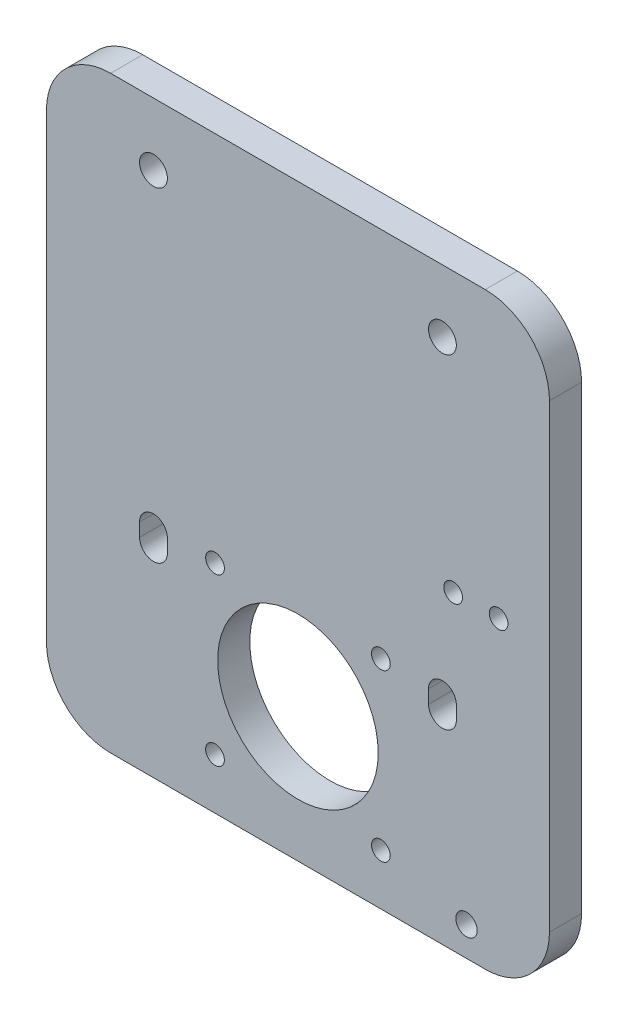
from build123d import *

# Parameters (mm, degrees)
MODEL_R                     = 15
MODEL_R_2                   = 2.6
BASE_DEPTH                  = 6
SKETCH2_R                   = 2
CABLETIEMOUNT_DEPTH         = 120.770614092
F_3_5_3_5_STEPPERMOUNT_D    = 3.5
F_3_5_3_5_CABLECHAINMOUNT_D = 3.5


with BuildPart() as part:
    # Model → Base (new body)
    with BuildSketch(Plane.XY):
        with BuildLine():
            Line((47, 12), (47, 98))
            ThreePointArc((47, 98), (43.485281374, 106.485281374), (35, 110))
            Line((35, 110), (-35, 110))
            ThreePointArc((-35, 110), (-43.485281374, 106.485281374), (-47, 98))
            Line((-47, 98), (-47, 12))
            ThreePointArc((-47, 12), (-43.485281374, 3.514718626), (-35, 0))
            Line((-35, 0), (35, 0))
            ThreePointArc((35, 0), (43.485281374, 3.514718626), (47, 12))
        make_face()
        with BuildLine():
            Line((-29.6, 37.6), (-29.6, 40.1))
            ThreePointArc((-29.6, 40.1), (-27, 42.7), (-24.4, 40.1))
            Line((-24.4, 40.1), (-24.4, 37.6))
            ThreePointArc((-24.4, 37.6), (-27, 35), (-29.6, 37.6))
        make_face(mode=Mode.SUBTRACT)
        with Locations((0, 25)):
            Circle(MODEL_R, mode=Mode.SUBTRACT)
        with BuildLine():
            Line((29.6, 40.1), (29.6, 37.6))
            ThreePointArc((29.6, 37.6), (27, 35), (24.4, 37.6))
            Line((24.4, 37.6), (24.4, 40.1))
            ThreePointArc((24.4, 40.1), (27, 42.7), (29.6, 40.1))
        make_face(mode=Mode.SUBTRACT)
        with Locations((-27, 98.3)):
            Circle(MODEL_R_2, mode=Mode.SUBTRACT)
        with Locations((27, 98.3)):
            Circle(MODEL_R_2, mode=Mode.SUBTRACT)
    extrude(amount=BASE_DEPTH)

    # Sketch2 → CableTieMount (cut, through all)
    with BuildSketch(Plane.XY.offset(6)):
        with Locations((31.5, 5.5)):
            Circle(SKETCH2_R)
    extrude(amount=-CABLETIEMOUNT_DEPTH, mode=Mode.SUBTRACT)

    # Ø3.5 (3.5) StepperMount (through all)
    with Locations(Plane.XY.offset(6)):
        with Locations((-15.5, 40.5), (-15.5, 9.5), (15.5, 9.5), (15.5, 40.5)):
            Hole(F_3_5_3_5_STEPPERMOUNT_D / 2)

    # Ø3.5 (3.5) CableChainMount (through all)
    with Locations(Plane(origin=(0, 0, 0), x_dir=(-1, 0, 0), z_dir=(0, 0, -1))):
        with Locations((-37.5, 58), (-29, 58)):
            Hole(F_3_5_3_5_CABLECHAINMOUNT_D / 2)


solid = part.part
